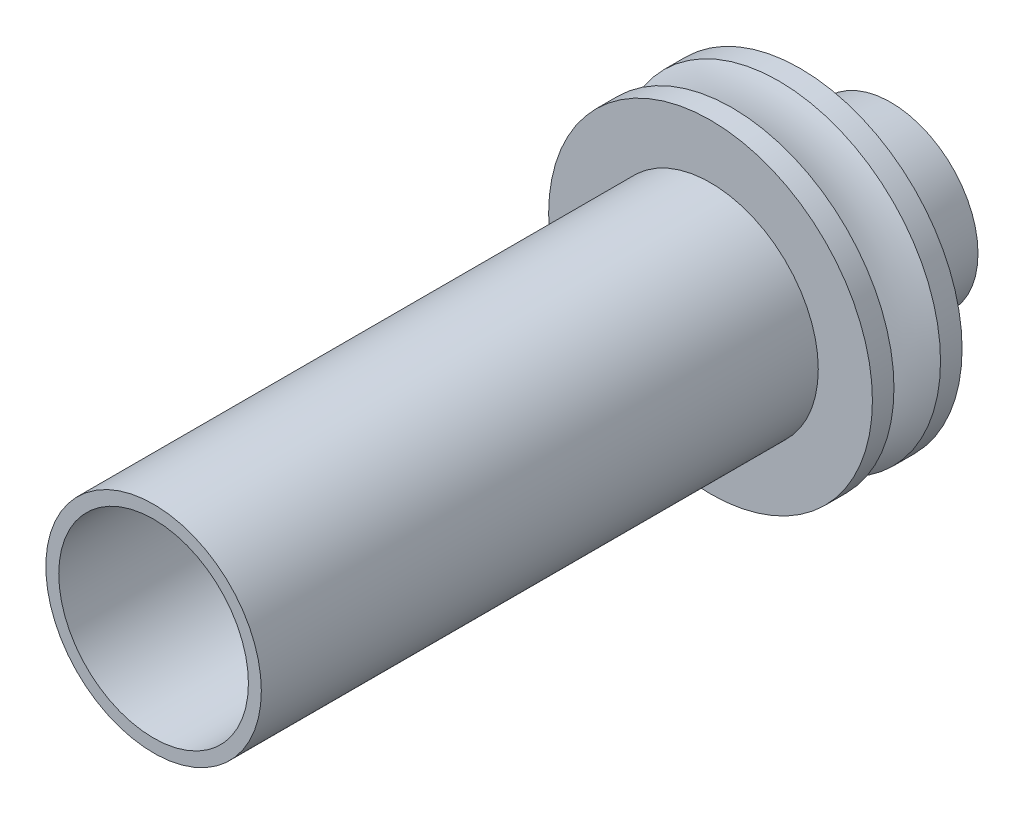
from build123d import *


# Read off the part's stored shape, not the designer's step: Shell1
with BuildPart() as part:
    # Sketch3 → Revolve1 (revolve)
    with BuildSketch(Plane(origin=(0, 0, 0), x_dir=(0, 0, -1), z_dir=(1, 0, 0)), mode=Mode.PRIVATE) as revolve1_sk:
        Polygon((-144.855352602, 25), (5.144647398, 25), (5.144647398, 22), (6.144647398, 22), (26.144647398, 20.250226729), (26.144647398, 0), (-144.855352602, 0), align=None)
    revolve(revolve1_sk.sketch.rotate(Axis((0, 0, 32.959641256), (0, 0, -1)), 90), axis=Axis((0, 0, 32.959641256), (0, 0, -1)))

    # Shell1 outline → Shell1 (revolve, cut)
    with BuildSketch(Plane.XZ):
        Polygon((19, -2.144647398), (22, -2.144647398), (22, 144.855352602), (0, 144.855352602), (0, -26.144647398), (17.238767217, -26.144647398), (19, -6.013664569), align=None)
    revolve(axis=Axis((0, 0, 0), (0, 0, 1)), mode=Mode.SUBTRACT)

    # Sketch4 → Revolve3 (revolve)
    with BuildSketch(Plane(origin=(0, 0, 0), x_dir=(0, 0, -1), z_dir=(1, 0, 0)), mode=Mode.PRIVATE) as revolve3_sk:
        with BuildLine():
            Line((-15.655352602, 37.557879022), (-15.655352602, 25))
            Line((-15.655352602, 25), (5.144647398, 25))
            Line((5.144647398, 25), (5.144647398, 37.557879022))
            Line((5.144647398, 37.557879022), (0.144647398, 37.557879022))
            ThreePointArc((0.144647398, 37.557879022), (-2.092417968, 32.142324694), (-2.855352602, 26.332796239))
            Line((-2.855352602, 26.332796239), (-7.655352602, 26.332796239))
            ThreePointArc((-7.655352602, 26.332796239), (-8.418287237, 32.142324694), (-10.655352602, 37.557879022))
            Line((-10.655352602, 37.557879022), (-15.655352602, 37.557879022))
        make_face()
    revolve(revolve3_sk.sketch.rotate(Axis((0, 0, -29.694647398), (0, 0, 1)), 90), axis=Axis((0, 0, -29.694647398), (0, 0, 1)))


solid = part.part
